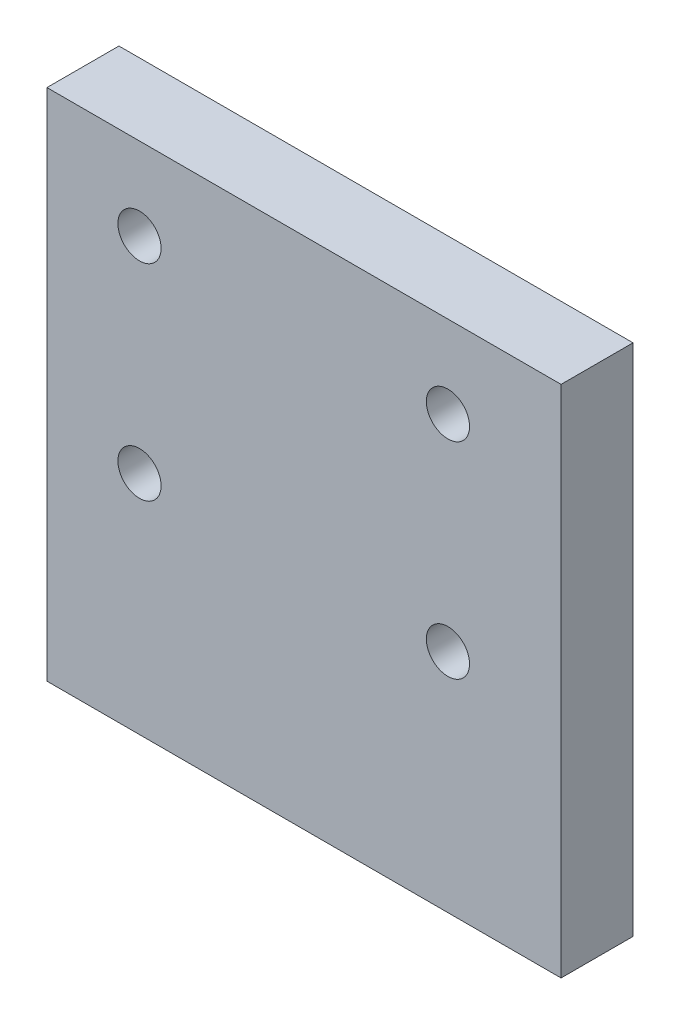
from build123d import *

# Parameters (mm, degrees)
SKETCH_1_W          = 50
SKETCH_1_H          = 50
EXTRUDE_1_DEPTH     = 7
SKETCH_2_R          = 2.1
CUT_EXTRUDE_1_DEPTH = 7


with BuildPart() as part:
    # 스케치1 → 보스-돌출1 (new body)
    with BuildSketch(Plane.XY):
        Rectangle(SKETCH_1_W, SKETCH_1_H)
    extrude(amount=EXTRUDE_1_DEPTH)

    # 스케치2 → 컷-돌출1 (cut)
    with BuildSketch(Plane.XY.offset(7)):
        with Locations((-16, -3)):
            Circle(SKETCH_2_R)
        with Locations((14, -3)):
            Circle(SKETCH_2_R)
        with Locations((-16, 17)):
            Circle(SKETCH_2_R)
        with Locations((14, 17)):
            Circle(SKETCH_2_R)
    extrude(amount=-CUT_EXTRUDE_1_DEPTH, mode=Mode.SUBTRACT)


solid = part.part
